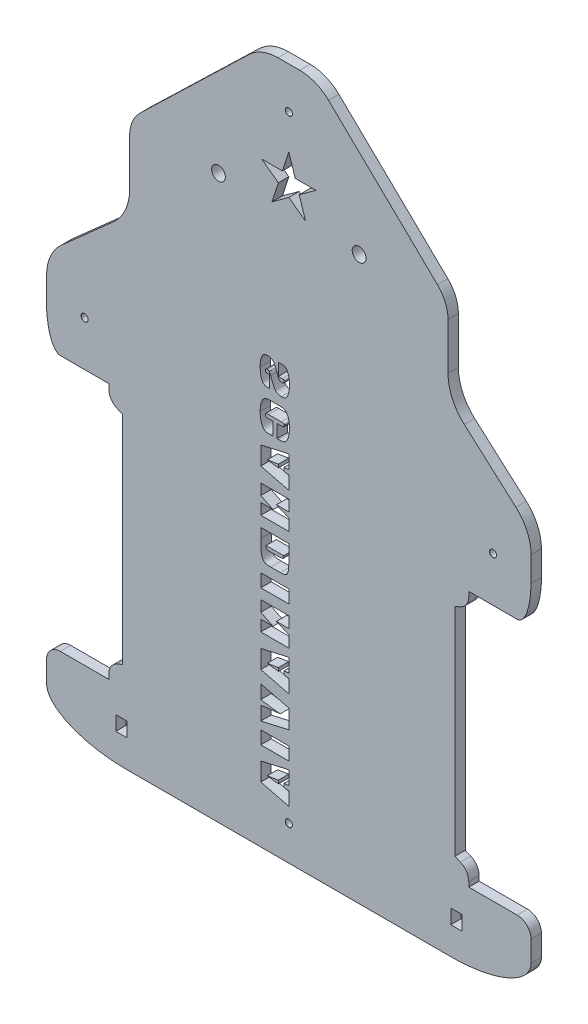
from build123d import *

# Parameters (mm, degrees)
BOSS_EXTRUDE1_DEPTH             = 3
FILLET1_SIZE                    = 23
FILLET1_SIZE_2                  = 10
FILLET2_SIZE                    = 23
FILLET2_SIZE_2                  = 10
FILLET3_R                       = 12
FILLET4_R                       = 4
FILLET5_SIZE                    = 4
FILLET5_SIZE_2                  = 11
MIRROR3_DEPTH                   = 3
FILLET6_R                       = 13
FILLET7_R                       = 4
SKETCH4_R                       = 2
CUT_EXTRUDE1_DEPTH              = 3
F_2_0MM_DOWEL_HOLE1_D           = 2
F_2_0MM_DOWEL_HOLE1_DEPTH       = 3
F_2_0MM_DOWEL_HOLE1_CSINK_D     = 2.05
F_2_0MM_DOWEL_HOLE1_CSINK_ANGLE = 90
F_2_0MM_DOWEL_HOLE1_TIP         = 0.600860619
SKETCH8_W                       = 3.2
SKETCH8_H                       = 4.18
CUT_EXTRUDE2_DEPTH              = 3
CUT_EXTRUDE3_DEPTH              = 3
SKETCH12_W                      = 8.094117647
SKETCH12_H                      = 3.764705883
SKETCH12_H_2                    = 3.764705882
CUT_EXTRUDE4_DEPTH              = 3


# Read off the part's stored shape, not the designer's step: Mirror3
with BuildPart() as part:
    # Sketch2 → Boss-Extrude1 (new body)
    with BuildSketch(Plane.XY):
        with BuildLine():
            Line((8, 200), (-8, 200))
            Line((-8, 200), (-42.946583705, 166.252476399))
            ThreePointArc((-42.946583705, 166.252476399), (-45.205048535, 162.96638968), (-46, 159.059078395))
            Line((-46, 159.059078395), (-46, 145.596532944))
            ThreePointArc((-46, 145.596532944), (-47.230610625, 139.856960225), (-50.706099285, 135.126413102))
            Line((-50.706099285, 135.126413102), (-70, 118))
            Line((-70, 118), (-70, 94))
            Line((-70, 94), (-52, 94))
            Line((-52, 94), (-52, 89.967489246))
            Line((-52, 89.967489246), (-48, 88.269589981))
            Line((-48, 88.269589981), (-48, 25.730410019))
            Line((-48, 25.730410019), (-52, 24.032510754))
            Line((-52, 24.032510754), (-52, 20))
            Line((-52, 20), (-70, 20))
            Line((-70, 20), (-70, 0))
            Line((-70, 0), (70, 0))
            Line((70, 0), (70, 20))
            Line((70, 20), (52, 20))
            Line((52, 20), (52, 24.032510754))
            Line((52, 24.032510754), (48, 25.730410019))
            Line((48, 25.730410019), (48, 88.269589981))
            Line((48, 88.269589981), (52, 89.967489246))
            Line((52, 89.967489246), (52, 94))
            Line((52, 94), (70, 94))
            Line((70, 94), (70, 118))
            Line((70, 118), (50.706099285, 135.126413102))
            ThreePointArc((50.706099285, 135.126413102), (47.230610625, 139.856960225), (46, 145.596532944))
            Line((46, 145.596532944), (46, 159.059078395))
            ThreePointArc((46, 159.059078395), (45.205048535, 162.96638968), (42.946583705, 166.252476399))
            Line((42.946583705, 166.252476399), (8, 200))
        make_face()
    extrude(amount=BOSS_EXTRUDE1_DEPTH)

    # Fillet1
    # an asymmetric fillet: 23, 10 mm, written as the material it takes off along each edge
    with BuildSketch(Plane(origin=(70, 0, -57.5), x_dir=(-1, 0, 0), z_dir=(0, 0, 1))) as fillet1_piece_1:
        with BuildLine():
            Bezier((FILLET1_SIZE, 0), (0, 0), (0, -FILLET1_SIZE_2), weights=[1, 0.707106781, 1])
            Line((0, -FILLET1_SIZE_2), (0, 0))
            Line((0, 0), (FILLET1_SIZE, 0))
        make_face()
    extrude(amount=118, mode=Mode.SUBTRACT)

    # Fillet2
    # an asymmetric fillet: 23, 10 mm, written as the material it takes off along each edge
    with BuildSketch(Plane(origin=(-70, 0, -57.5), x_dir=(1, 0, 0), z_dir=(0, 0, 1))) as fillet2_piece_1:
        with BuildLine():
            Bezier((FILLET2_SIZE, 0), (0, 0), (0, FILLET2_SIZE_2), weights=[1, 0.707106781, 1])
            Line((0, FILLET2_SIZE_2), (0, 0))
            Line((0, 0), (FILLET2_SIZE, 0))
        make_face()
    extrude(amount=118, mode=Mode.SUBTRACT)

    # Fillet3
    fillet3_edges = [part.edges().sort_by_distance(p)[0] for p in [
        (-8, 200, 1.5),
        (8, 200, 1.5),
    ]]
    fillet(fillet3_edges, radius=FILLET3_R)

    # Fillet4
    fillet4_edges = [part.edges().sort_by_distance(p)[0] for p in [
        (52, 89.967489246, 1.5),
        (52, 24.032510754, 1.5),
        (-52, 24.032510754, 1.5),
        (-52, 89.967489246, 1.5),
    ]]
    fillet(fillet4_edges, radius=FILLET4_R)

    # Fillet5
    # an asymmetric fillet: 11, 4 mm, written as the material it takes off along each edge
    with BuildSketch(Plane(origin=(-70, 94, -27.5), x_dir=(1, 0, 0), z_dir=(0, 0, 1))) as fillet5_piece_1:
        with BuildLine():
            Bezier((FILLET5_SIZE, 0), (0, 0), (0, FILLET5_SIZE_2), weights=[1, 0.707106781, 1])
            Line((0, FILLET5_SIZE_2), (0, 0))
            Line((0, 0), (FILLET5_SIZE, 0))
        make_face()
    extrude(amount=58, mode=Mode.SUBTRACT)

    # Mirror3 outline → Mirror3 (cut)
    with BuildSketch(Plane.XY):
        with BuildLine():
            add(Edge.make_bspline(
                [(66, 94), (70, 94), (70, 105)],
                knots=[0, 0, 0, 1, 1, 1], degree=2, weights=[1, 0.707106781, 1]))
            Line((66, 94), (70, 94))
            Line((70, 94), (70, 105))
        make_face()
    extrude(amount=MIRROR3_DEPTH, mode=Mode.SUBTRACT)

    # Fillet6
    fillet6_edges = [part.edges().sort_by_distance(p)[0] for p in [
        (-70, 118, 1.5),
        (70, 118, 1.5),
    ]]
    fillet(fillet6_edges, radius=FILLET6_R)

    # Fillet7
    fillet7_edges = [part.edges().sort_by_distance(p)[0] for p in [
        (-70, 20, 1.5),
        (70, 20, 1.5),
    ]]
    fillet(fillet7_edges, radius=FILLET7_R)

    # Sketch4 → Cut-Extrude1 (cut)
    with BuildSketch(Plane.XY.offset(3)):
        with Locations((20.32, 162.5)):
            Circle(SKETCH4_R)
        with Locations((-20.32, 162.5)):
            Circle(SKETCH4_R)
    extrude(amount=-CUT_EXTRUDE1_DEPTH, mode=Mode.SUBTRACT)

    # Ø2.0mm Dowel Hole1
    with Locations(Plane.XY.offset(3)):
        with Locations((59, 107), (-59, 107), (0, 10), (0, 188)):
            CounterSinkHole(F_2_0MM_DOWEL_HOLE1_D / 2, F_2_0MM_DOWEL_HOLE1_CSINK_D / 2, depth=F_2_0MM_DOWEL_HOLE1_DEPTH, counter_sink_angle=F_2_0MM_DOWEL_HOLE1_CSINK_ANGLE)
            with Locations((0, 0, -(F_2_0MM_DOWEL_HOLE1_DEPTH + F_2_0MM_DOWEL_HOLE1_TIP / 2))):  # 118° drill point
                Cone(0, F_2_0MM_DOWEL_HOLE1_D / 2, F_2_0MM_DOWEL_HOLE1_TIP, mode=Mode.SUBTRACT)

    # Sketch8 → Cut-Extrude2 (cut)
    with BuildSketch(Plane(origin=(0, 0, 0), x_dir=(-1, 0, 0), z_dir=(0, 0, -1))):
        with Locations((-48.4, 10.09)):
            Rectangle(SKETCH8_W, SKETCH8_H)
    cut_extrude2 = extrude(amount=-CUT_EXTRUDE2_DEPTH, mode=Mode.SUBTRACT)

    # Mirror4: Cut-Extrude2 across plane
    add(cut_extrude2.mirror(Plane(origin=(0, 0, 0), x_dir=(0, 0, 1), z_dir=(1, 0, 0))), mode=Mode.SUBTRACT)

    # Sketch9 → Cut-Extrude3 (cut)
    with BuildSketch(Plane(origin=(0, 0, 0), x_dir=(-1, 0, 0), z_dir=(0, 0, -1))):
        Polygon((0, 166.587321804), (-4.854101966, 163.060610291), (-3, 168.766949388), (-7.854101966, 172.293660902), (-1.854101966, 172.293660902), (0, 178), (1.854101966, 172.293660902), (7.854101966, 172.293660902), (3, 168.766949388), (4.854101966, 163.060610291), align=None)
    extrude(amount=-CUT_EXTRUDE3_DEPTH, mode=Mode.SUBTRACT)

    # Sketch12 → Cut-Extrude4 (cut)
    # profile 1 of 11: a face of its own
    with BuildSketch(Plane(origin=(0, 0, 0), x_dir=(-1, 0, 0), z_dir=(0, 0, -1))):
        Polygon((8.094117647, 16.254117647), (0, 14.230588235), (0, 18.055588235), (1.411764706, 18.242352941), (1.411764706, 19.257058824), (0, 19.443823529), (0, 23.36), (8.094117647, 21.530588235), align=None)
        with BuildLine():
            add(Edge.make_bspline(
                [(3.011764706, 18.320294118), (3.118579377, 18.339204457), (3.340301315, 18.37845784), (3.685047135, 18.433650847), (4.053185485, 18.489598862), (4.443799062, 18.545659213), (4.858142451, 18.599740111), (5.295432456, 18.653928694), (5.756206062, 18.708509228), (6.071056054, 18.74352969), (6.232352941, 18.761470588)],
                knots=[0, 0, 0, 0, 0.800721052, 1.66210711, 2.577115263, 3.549400435, 4.574967221, 5.661551264, 6.802018386, 8, 8, 8, 8], degree=3))
            add(Edge.make_bspline(
                [(6.232352941, 18.761470588), (6.047038541, 18.787308039), (5.691034923, 18.836943824), (5.179287936, 18.91061554), (4.710993534, 18.979221936), (4.286569561, 19.04554254), (3.905669031, 19.107233612), (3.568683071, 19.163911742), (3.275593755, 19.21830566), (3.095056481, 19.254887494), (3.011764706, 19.271764706)],
                knots=[0, 0, 0, 0, 1.37693435, 2.645199778, 3.804813673, 4.859913969, 5.806434619, 6.644422833, 7.374597688, 8, 8, 8, 8], degree=3))
            Line((3.011764706, 19.271764706), (3.011764706, 18.320294118))
        make_face(mode=Mode.SUBTRACT)
    # profile 2 of 11: a face of its own
    with BuildSketch(Plane(origin=(0, 0, 0), x_dir=(-1, 0, 0), z_dir=(0, 0, -1))):
        with Locations((4.047058824, 27.444705883)):
            Rectangle(SKETCH12_W, SKETCH12_H)
    # profile 3 of 11: a face of its own
    with BuildSketch(Plane(origin=(0, 0, 0), x_dir=(-1, 0, 0), z_dir=(0, 0, -1))):
        with BuildLine():
            Line((8.094117647, 31.529411765), (0, 33.363235294))
            Line((0, 33.363235294), (0, 38.827941176))
            Line((0, 38.827941176), (8.094117647, 40.847058824))
            Line((8.094117647, 40.847058824), (8.094117647, 36.914705882))
            add(Edge.make_bspline(
                [(8.094117647, 36.914705882), (7.819247392, 36.863010741), (7.281822949, 36.761936754), (6.491385591, 36.625711555), (5.736583227, 36.503194736), (5.016487904, 36.39668137), (4.331964967, 36.307455525), (3.682535835, 36.231479981), (3.068176256, 36.172137715), (2.669668987, 36.143362257), (2.476470588, 36.129411765)],
                knots=[0, 0, 0, 0, 1.182674028, 2.312356176, 3.391595161, 4.41614021, 5.390322273, 6.310535267, 7.180938701, 8, 8, 8, 8], degree=3))
            add(Edge.make_bspline(
                [(2.476470588, 36.129411765), (2.662759325, 36.114389487), (3.030021968, 36.084773519), (3.573235168, 36.037950375), (4.101194315, 35.987945527), (4.613971711, 35.935139452), (5.111561068, 35.879390972), (5.593798264, 35.820003942), (6.061170552, 35.760707308), (6.367208644, 35.717049165), (6.517647059, 35.695588235)],
                knots=[0, 0, 0, 0, 1.10339171, 2.175303578, 3.218915992, 4.234298085, 5.218648938, 6.174929363, 7.102854382, 8, 8, 8, 8], degree=3))
            Line((6.517647059, 35.695588235), (8.094117647, 35.470588235))
            Line((8.094117647, 35.470588235), (8.094117647, 31.529411765))
        make_face()
    # profile 4 of 11: a face of its own
    with BuildSketch(Plane(origin=(0, 0, 0), x_dir=(-1, 0, 0), z_dir=(0, 0, -1))):
        Polygon((8.094117647, 44.414117647), (0, 42.390588235), (0, 46.215588235), (1.411764706, 46.402352941), (1.411764706, 47.417058824), (0, 47.603823529), (0, 51.52), (8.094117647, 49.690588235), align=None)
        with BuildLine():
            add(Edge.make_bspline(
                [(3.011764706, 46.480294118), (3.118579377, 46.499204457), (3.340301315, 46.53845784), (3.685047135, 46.593650847), (4.053185485, 46.649598862), (4.443799062, 46.705659213), (4.858142451, 46.759740111), (5.295432456, 46.813928694), (5.756206062, 46.868509228), (6.071056054, 46.90352969), (6.232352941, 46.921470588)],
                knots=[0, 0, 0, 0, 0.800721052, 1.66210711, 2.577115263, 3.549400435, 4.574967221, 5.661551264, 6.802018386, 8, 8, 8, 8], degree=3))
            add(Edge.make_bspline(
                [(6.232352941, 46.921470588), (6.047038541, 46.947308039), (5.691034923, 46.996943824), (5.179287936, 47.07061554), (4.710993534, 47.139221936), (4.286569561, 47.20554254), (3.905669031, 47.267233612), (3.568683071, 47.323911742), (3.275593755, 47.37830566), (3.095056481, 47.414887494), (3.011764706, 47.431764706)],
                knots=[0, 0, 0, 0, 1.37693435, 2.645199778, 3.804813673, 4.859913969, 5.806434619, 6.644422833, 7.374597688, 8, 8, 8, 8], degree=3))
            Line((3.011764706, 47.431764706), (3.011764706, 46.480294118))
        make_face(mode=Mode.SUBTRACT)
    # profile 5 of 11: a face of its own
    with BuildSketch(Plane(origin=(0, 0, 0), x_dir=(-1, 0, 0), z_dir=(0, 0, -1))):
        Polygon((8.094117647, 53.816470588), (0, 53.816470588), (0, 57.170882353), (3.594117647, 58.710588235), (0, 58.710588235), (0, 61.910588235), (8.094117647, 61.910588235), (8.094117647, 58.763529412), (4.533823529, 57.016470588), (8.094117647, 57.016470588), align=None)
    # profile 6 of 11: a face of its own
    with BuildSketch(Plane(origin=(0, 0, 0), x_dir=(-1, 0, 0), z_dir=(0, 0, -1))):
        with Locations((4.047058824, 66.748235294)):
            Rectangle(SKETCH12_W, SKETCH12_H_2)
    # profile 7 of 11: a face of its own
    with BuildSketch(Plane(origin=(0, 0, 0), x_dir=(-1, 0, 0), z_dir=(0, 0, -1))):
        with BuildLine():
            Line((8.094117647, 79.962352941), (8.094117647, 77.222647059))
            add(Edge.make_bspline(
                [(8.094117647, 77.222647059), (8.094459075, 77.117252992), (8.095127654, 76.910871943), (8.090343637, 76.607951528), (8.090834883, 76.317722786), (8.084910718, 76.040300362), (8.081922255, 75.775543137), (8.073560753, 75.523623828), (8.06617133, 75.284415055), (8.05995299, 75.057855608), (8.048529142, 74.844213857), (8.038933491, 74.643171064), (8.027284717, 74.454907459), (8.013476009, 74.279492438), (8.001052282, 74.117116752), (7.985946834, 73.967134197), (7.970452535, 73.830251582), (7.946453974, 73.666479664), (7.91601603, 73.476564815), (7.869559696, 73.260957739), (7.818926465, 73.058601994), (7.761498018, 72.869630483), (7.698272739, 72.694371771), (7.630090911, 72.532046688), (7.55274458, 72.38419017), (7.470616161, 72.249502852), (7.385689496, 72.126741002), (7.296372894, 72.017833241), (7.207674628, 71.919003645), (7.116437485, 71.832994729), (7.022592937, 71.760875154), (6.928911633, 71.697625427), (6.831110147, 71.649467763), (6.728823086, 71.610728659), (6.613939748, 71.583425535), (6.480938018, 71.55864696), (6.325017098, 71.536259195), (6.145730377, 71.521618751), (5.944239105, 71.508299612), (5.720189214, 71.497944265), (5.4735604, 71.492217972), (5.301473631, 71.491920026), (5.211764706, 71.491764706)],
                knots=[0, 0, 0, 0, 1.666520981, 3.263355872, 4.790373839, 6.255546593, 7.650967229, 8.976999245, 10.241048968, 11.435372061, 12.56061375, 13.623921692, 14.618018947, 15.543053204, 16.406266635, 17.192971833, 17.926562188, 18.584278441, 19.810154422, 20.967067361, 22.070608396, 23.107801184, 24.088573033, 25.015780601, 25.889440834, 26.724277126, 27.509147262, 28.247594668, 28.949929009, 29.608010559, 30.226656321, 30.820020239, 31.391987628, 31.946297594, 32.546006754, 33.255956197, 34.085775594, 35.035265442, 36.099477078, 37.278917374, 38.581498173, 40, 40, 40, 40], degree=3))
            Line((5.211764706, 71.491764706), (2.442647059, 71.491764706))
            add(Edge.make_bspline(
                [(2.442647059, 71.491764706), (2.357339753, 71.492211998), (2.19402889, 71.493068288), (1.960193591, 71.502695231), (1.747611937, 71.514233746), (1.556514824, 71.53591291), (1.385694637, 71.558864307), (1.236734049, 71.592084081), (1.108216795, 71.627232434), (0.965757335, 71.684101938), (0.810770594, 71.78006035), (0.647876044, 71.929404898), (0.504142097, 72.11417675), (0.384258836, 72.334991041), (0.282535402, 72.583688129), (0.198491663, 72.856236463), (0.128470333, 73.150239182), (0.088034658, 73.412546464), (0.063587266, 73.641111321), (0.04572183, 73.834716844), (0.031289873, 74.048508722), (0.019688456, 74.282371146), (0.010918665, 74.536323781), (0.005670622, 74.809888897), (0.000644231, 75.10302169), (0.000219547, 75.304997438), (0, 75.409411765)],
                knots=[0, 0, 0, 0, 1.116015087, 2.136480409, 3.061820122, 3.900390244, 4.652297892, 5.315245783, 5.895796426, 6.393614494, 7.317552935, 8.261922104, 9.271608702, 10.365474368, 11.538646095, 12.782079459, 14.093470504, 15.489498866, 16.250865527, 17.10093279, 18.033092846, 19.054122318, 20.164317328, 21.357495989, 22.633918784, 24, 24, 24, 24], degree=3))
            Line((0, 75.409411765), (0, 79.962352941))
            Line((0, 79.962352941), (8.094117647, 79.962352941))
        make_face()
        with BuildLine():
            Line((6.588235294, 76.197647059), (1.505882353, 76.197647059))
            add(Edge.make_bspline(
                [(1.505882353, 76.197647059), (1.506514805, 76.1491092), (1.507722981, 76.056386989), (1.5148729, 75.92438646), (1.526619634, 75.806144784), (1.541637012, 75.70166642), (1.564038141, 75.611331705), (1.589496571, 75.534420832), (1.620710597, 75.471706603), (1.6566916, 75.418333428), (1.710026689, 75.379051708), (1.777795877, 75.344698875), (1.865209139, 75.318806274), (1.970655757, 75.294647199), (2.095290788, 75.278640766), (2.238456006, 75.264938415), (2.400434034, 75.258414476), (2.51470325, 75.257142026), (2.575, 75.256470588)],
                knots=[0, 0, 0, 0, 1.330565612, 2.541788812, 3.622135562, 4.587567132, 5.431661566, 6.171080269, 6.802062011, 7.350363739, 7.914890912, 8.593974043, 9.42687081, 10.404845201, 11.558343011, 12.867360962, 14.346991784, 16, 16, 16, 16], degree=3))
            Line((2.575, 75.256470588), (5.688235294, 75.256470588))
            add(Edge.make_bspline(
                [(5.688235294, 75.256470588), (5.729899907, 75.257032795), (5.808818232, 75.258097689), (5.92112981, 75.25851004), (6.021130761, 75.263397038), (6.108441302, 75.268836121), (6.183011454, 75.276145595), (6.244875952, 75.284759378), (6.294675595, 75.294415013), (6.345293209, 75.309750836), (6.397957027, 75.341599293), (6.448442114, 75.399484271), (6.492800625, 75.47395849), (6.527602664, 75.569759685), (6.555204245, 75.688656649), (6.574783607, 75.833854985), (6.585741727, 76.006792139), (6.587364055, 76.130963373), (6.588235294, 76.197647059)],
                knots=[0, 0, 0, 0, 1.236430555, 2.341964124, 3.332002206, 4.206653537, 4.937542564, 5.554644633, 6.059554984, 6.441350093, 7.119850631, 7.850739657, 8.698865329, 9.679455857, 10.861295382, 12.315600714, 14.021366786, 16, 16, 16, 16], degree=3))
        make_face(mode=Mode.SUBTRACT)
    # profile 8 of 11: a face of its own
    with BuildSketch(Plane(origin=(0, 0, 0), x_dir=(-1, 0, 0), z_dir=(0, 0, -1))):
        Polygon((8.094117647, 83.011764706), (0, 83.011764706), (0, 86.366176471), (3.594117647, 87.905882353), (0, 87.905882353), (0, 91.105882353), (8.094117647, 91.105882353), (8.094117647, 87.958823529), (4.533823529, 86.211764706), (8.094117647, 86.211764706), align=None)
    # profile 9 of 11: a face of its own
    with BuildSketch(Plane(origin=(0, 0, 0), x_dir=(-1, 0, 0), z_dir=(0, 0, -1))):
        Polygon((8.094117647, 95.331764706), (0, 93.308235294), (0, 97.133235294), (1.411764706, 97.32), (1.411764706, 98.334705882), (0, 98.521470588), (0, 102.437647059), (8.094117647, 100.608235294), align=None)
        with BuildLine():
            add(Edge.make_bspline(
                [(3.011764706, 97.397941176), (3.118579377, 97.416851516), (3.340301315, 97.456104899), (3.685047135, 97.511297906), (4.053185485, 97.567245921), (4.443799062, 97.623306272), (4.858142451, 97.67738717), (5.295432456, 97.731575752), (5.756206062, 97.786156287), (6.071056054, 97.821176749), (6.232352941, 97.839117647)],
                knots=[0, 0, 0, 0, 0.800721052, 1.66210711, 2.577115263, 3.549400435, 4.574967221, 5.661551264, 6.802018386, 8, 8, 8, 8], degree=3))
            add(Edge.make_bspline(
                [(6.232352941, 97.839117647), (6.047038541, 97.864955098), (5.691034923, 97.914590883), (5.179287936, 97.988262599), (4.710993534, 98.056868994), (4.286569561, 98.123189599), (3.905669031, 98.184880671), (3.568683071, 98.241558801), (3.275593755, 98.295952719), (3.095056481, 98.332534553), (3.011764706, 98.349411765)],
                knots=[0, 0, 0, 0, 1.37693435, 2.645199778, 3.804813673, 4.859913969, 5.806434619, 6.644422833, 7.374597688, 8, 8, 8, 8], degree=3))
            Line((3.011764706, 98.349411765), (3.011764706, 97.397941176))
        make_face(mode=Mode.SUBTRACT)
    # profile 10 of 11: a face of its own
    with BuildSketch(Plane(origin=(0, 0, 0), x_dir=(-1, 0, 0), z_dir=(0, 0, -1))):
        with BuildLine():
            Line((4.517647059, 104.545882353), (4.517647059, 108.310588235))
            Line((4.517647059, 108.310588235), (5.979411765, 108.310588235))
            add(Edge.make_bspline(
                [(5.979411765, 108.310588235), (6.024023135, 108.310837228), (6.108368354, 108.311307989), (6.228039662, 108.315647853), (6.333982446, 108.322856105), (6.426357822, 108.332482021), (6.504241288, 108.346072337), (6.56882644, 108.359530807), (6.619345187, 108.378465709), (6.671004081, 108.407902408), (6.718534847, 108.469399297), (6.752351691, 108.56827202), (6.773513347, 108.696969477), (6.775417235, 108.792840371), (6.776470588, 108.845882353)],
                knots=[0, 0, 0, 0, 1.380943683, 2.61090383, 3.706083904, 4.66794713, 5.483697493, 6.153604121, 6.705956583, 7.148359332, 7.97796424, 9.034731194, 10.359421431, 12, 12, 12, 12], degree=3))
            add(Edge.make_bspline(
                [(6.776470588, 108.845882353), (6.774815665, 108.8939839), (6.771782201, 108.982153766), (6.749899935, 109.10189132), (6.704862681, 109.193731318), (6.65070349, 109.250099908), (6.593643103, 109.280315265), (6.535712747, 109.295731104), (6.464810107, 109.312533759), (6.3787893, 109.325625708), (6.278003033, 109.333033812), (6.162848059, 109.341013063), (6.033361832, 109.345093203), (5.942158824, 109.345610085), (5.894117647, 109.345882353)],
                knots=[0, 0, 0, 0, 1.440123002, 2.639737395, 3.610577474, 4.461049287, 4.926964245, 5.525469804, 6.247768684, 7.108674582, 8.124562814, 9.270989093, 10.562493707, 12, 12, 12, 12], degree=3))
            Line((5.894117647, 109.345882353), (2.166176471, 109.345882353))
            add(Edge.make_bspline(
                [(2.166176471, 109.345882353), (2.120096988, 109.345603223), (2.032326304, 109.345071545), (1.907726791, 109.341054956), (1.797020137, 109.332968047), (1.700035846, 109.325875877), (1.617887456, 109.311643443), (1.548837062, 109.298530409), (1.494552223, 109.278920572), (1.438132398, 109.253143258), (1.386168498, 109.197795403), (1.345951578, 109.110386509), (1.321716938, 108.998600188), (1.319088464, 108.916115416), (1.317647059, 108.870882353)],
                knots=[0, 0, 0, 0, 1.443283468, 2.74911894, 3.903165773, 4.920656302, 5.791468973, 6.514212296, 7.116324427, 7.596955945, 8.443751978, 9.41877152, 10.584503915, 12, 12, 12, 12], degree=3))
            add(Edge.make_bspline(
                [(1.317647059, 108.870882353), (1.318561914, 108.816751382), (1.320226204, 108.718277222), (1.35003228, 108.586373008), (1.393566715, 108.482168455), (1.453307437, 108.41782849), (1.516908133, 108.387494076), (1.577591634, 108.364971384), (1.654333422, 108.348372844), (1.746376999, 108.336058748), (1.853715257, 108.324022916), (1.976830484, 108.315292785), (2.115170236, 108.311438891), (2.212253348, 108.310881134), (2.263235294, 108.310588235)],
                knots=[0, 0, 0, 0, 1.487279482, 2.705634021, 3.702307848, 4.571083054, 5.04206048, 5.631468785, 6.35195354, 7.19776708, 8.189215244, 9.326159486, 10.595867092, 12, 12, 12, 12], degree=3))
            Line((2.263235294, 108.310588235), (3.388235294, 108.310588235))
            Line((3.388235294, 108.310588235), (3.388235294, 104.545882353))
            Line((3.388235294, 104.545882353), (2.980882353, 104.545882353))
            add(Edge.make_bspline(
                [(2.980882353, 104.545882353), (2.880373143, 104.546548277), (2.687079664, 104.547828945), (2.407896024, 104.56259008), (2.150794127, 104.587297455), (1.915191406, 104.620857926), (1.700539355, 104.662300913), (1.508343641, 104.716387118), (1.337666095, 104.779845302), (1.184177909, 104.85222797), (1.044976375, 104.944719989), (0.915590607, 105.060347475), (0.787922375, 105.196277544), (0.666559511, 105.357754046), (0.54930511, 105.542749836), (0.434645438, 105.749651971), (0.326262495, 105.981153429), (0.220835206, 106.233326835), (0.124153868, 106.505494968), (0.040429644, 106.794273562), (-0.029372267, 107.097886131), (-0.089053421, 107.415586398), (-0.131945201, 107.748612461), (-0.163991538, 108.095889743), (-0.185819377, 108.457859825), (-0.18741976, 108.704182926), (-0.188235294, 108.829705882)],
                knots=[0, 0, 0, 0, 1.168564992, 2.247316372, 3.249460331, 4.170787558, 5.01361212, 5.789484374, 6.489272818, 7.129114089, 7.758280136, 8.424755988, 9.142557061, 9.923437686, 10.769321024, 11.687752321, 12.671872344, 13.73990979, 14.864818792, 16.028243291, 17.23383569, 18.485904426, 19.785337565, 21.136300329, 22.540696968, 24, 24, 24, 24], degree=3))
            add(Edge.make_bspline(
                [(-0.188235294, 108.829705882), (-0.186867775, 108.956677075), (-0.184189909, 109.205311151), (-0.170253301, 109.569787575), (-0.143545223, 109.917509702), (-0.106900517, 110.248593261), (-0.060991626, 110.563378551), (-0.001023136, 110.860786692), (0.06491309, 111.142189362), (0.145173399, 111.405318253), (0.232054479, 111.650345073), (0.328776553, 111.874705382), (0.435090892, 112.076882765), (0.548035352, 112.259106998), (0.669923688, 112.420286419), (0.801144773, 112.55994216), (0.941882668, 112.676751703), (1.09212481, 112.775105026), (1.257147364, 112.854227258), (1.437230119, 112.923187162), (1.635640399, 112.982658916), (1.852946298, 113.02759903), (2.087730576, 113.066945749), (2.340686684, 113.09256073), (2.612089882, 113.106707057), (2.799002393, 113.109265946), (2.895588235, 113.110588235)],
                knots=[0, 0, 0, 0, 1.484325832, 2.906596163, 4.262875816, 5.560128654, 6.800047893, 7.980045448, 9.105827886, 10.177210937, 11.194061489, 12.143633622, 13.030498899, 13.862044853, 14.647117472, 15.388898684, 16.096910203, 16.780355614, 17.482545912, 18.23172706, 19.033068696, 19.900751082, 20.823970526, 21.814965337, 22.87089735, 24, 24, 24, 24], degree=3))
            Line((2.895588235, 113.110588235), (5.217647059, 113.110588235))
            add(Edge.make_bspline(
                [(5.217647059, 113.110588235), (5.28823613, 113.110282815), (5.425017196, 113.109691001), (5.623618532, 113.105809397), (5.808927492, 113.096663684), (5.981036101, 113.085108073), (6.139462484, 113.070718992), (6.284598153, 113.052890815), (6.41677886, 113.033048322), (6.538261472, 113.007920396), (6.653219712, 112.97584144), (6.764292903, 112.929109562), (6.874069653, 112.870528093), (6.982577626, 112.798782927), (7.089909129, 112.714340896), (7.197408051, 112.617873113), (7.301171498, 112.506079903), (7.406184377, 112.384592733), (7.506935651, 112.250311605), (7.601526924, 112.102988207), (7.691058553, 111.944478325), (7.77467509, 111.773473071), (7.85306501, 111.590510937), (7.923768449, 111.395030625), (7.992828632, 111.188743235), (8.072735592, 110.892672703), (8.158357167, 110.500810773), (8.231809304, 110.004702896), (8.273940703, 109.477503031), (8.279498776, 109.115566449), (8.282352941, 108.929705882)],
                knots=[0, 0, 0, 0, 0.982054364, 1.902935426, 2.76318596, 3.562948923, 4.302622447, 4.975940605, 5.597091246, 6.161518339, 6.701090746, 7.254534423, 7.834205313, 8.430018618, 9.061638202, 9.732777051, 10.437086242, 11.181960195, 11.966220812, 12.770159808, 13.616044794, 14.49747069, 15.417113583, 16.383726367, 17.388694944, 18.442591325, 20.648378957, 22.965015719, 25.414450259, 28, 28, 28, 28], degree=3))
            add(Edge.make_bspline(
                [(8.282352941, 108.929705882), (8.281318749, 108.799780301), (8.2792962, 108.545687257), (8.260691059, 108.172503358), (8.233638943, 107.815841427), (8.194580398, 107.475179371), (8.14107982, 107.151578548), (8.078241518, 106.844377412), (8.005447441, 106.552810575), (7.918446073, 106.280030537), (7.825277276, 106.026078583), (7.725255984, 105.794248185), (7.619587578, 105.584791426), (7.5085427, 105.397298877), (7.39077057, 105.233561094), (7.268360417, 105.091428125), (7.138515221, 104.973604549), (7.001905572, 104.874696162), (6.852312751, 104.796655036), (6.689113099, 104.728357047), (6.508854988, 104.671812348), (6.310987585, 104.626698689), (6.096957663, 104.590227534), (5.865280669, 104.563650289), (5.616345524, 104.549828555), (5.444622973, 104.547226836), (5.355882353, 104.545882353)],
                knots=[0, 0, 0, 0, 1.536264436, 3.004443811, 4.417307976, 5.765429754, 7.057634557, 8.294491465, 9.472620814, 10.609250006, 11.678476474, 12.670231135, 13.593105288, 14.45101634, 15.244129499, 15.975370124, 16.664747073, 17.312978147, 17.963898988, 18.655028346, 19.402987278, 20.194595055, 21.053210789, 21.969232975, 22.950565749, 24, 24, 24, 24], degree=3))
            Line((5.355882353, 104.545882353), (4.517647059, 104.545882353))
        make_face()
    # profile 11 of 11: a face of its own
    with BuildSketch(Plane(origin=(0, 0, 0), x_dir=(-1, 0, 0), z_dir=(0, 0, -1))):
        with BuildLine():
            Line((5.552941176, 115.971764706), (5.552941176, 119.548235294))
            Line((5.552941176, 119.548235294), (6.233823529, 119.548235294))
            add(Edge.make_bspline(
                [(6.233823529, 119.548235294), (6.289781418, 119.549017531), (6.390280134, 119.550422406), (6.523026829, 119.567465667), (6.622368191, 119.591847913), (6.692537512, 119.634495036), (6.732163356, 119.697430815), (6.758012852, 119.773360364), (6.773421649, 119.866764186), (6.775401347, 119.934941772), (6.776470588, 119.971764706)],
                knots=[0, 0, 0, 0, 1.629798103, 2.92706929, 3.894631295, 4.596038628, 5.253892918, 6.013159222, 6.9269009, 8, 8, 8, 8], degree=3))
            add(Edge.make_bspline(
                [(6.776470588, 119.971764706), (6.775188398, 120.002799117), (6.772710395, 120.06277725), (6.750178376, 120.147083865), (6.714660881, 120.222169908), (6.661425357, 120.285629945), (6.588831033, 120.338592261), (6.491082285, 120.372139222), (6.370410099, 120.391634917), (6.281956443, 120.394004621), (6.233823529, 120.395294118)],
                knots=[0, 0, 0, 0, 0.93964134, 1.81598206, 2.627218597, 3.440088498, 4.302571649, 5.318842577, 6.541022217, 8, 8, 8, 8], degree=3))
            add(Edge.make_bspline(
                [(6.233823529, 120.395294118), (6.170953961, 120.393684197), (6.055488515, 120.390727438), (5.897392447, 120.36798611), (5.76719842, 120.330790603), (5.699703183, 120.28511136), (5.669117647, 120.264411765)],
                knots=[0, 0, 0, 0, 1.279067043, 2.3491182, 3.251901224, 4, 4, 4, 4], degree=3))
            add(Edge.make_bspline(
                [(5.669117647, 120.264411765), (5.650909738, 120.248275004), (5.611223308, 120.213102903), (5.559328512, 120.143144956), (5.505428181, 120.05783612), (5.448672893, 119.955032323), (5.392995644, 119.833480012), (5.333513269, 119.695131911), (5.275288373, 119.538708634), (5.237475859, 119.42822926), (5.217647059, 119.370294118)],
                knots=[0, 0, 0, 0, 0.576140738, 1.255771241, 2.056225654, 2.972739952, 4.039744693, 5.228343764, 6.546549526, 8, 8, 8, 8], degree=3))
            add(Edge.make_bspline(
                [(5.217647059, 119.370294118), (5.184536355, 119.272178199), (5.119699519, 119.080049215), (5.020966862, 118.799887627), (4.925610573, 118.532949075), (4.83150868, 118.280655083), (4.74030031, 118.042425365), (4.652634371, 117.818444338), (4.565108237, 117.609622491), (4.482094025, 117.413942185), (4.399649205, 117.232534564), (4.318360458, 117.066035433), (4.243196852, 116.911596225), (4.165874196, 116.774525641), (4.09413787, 116.649683857), (4.024017751, 116.539385652), (3.954892739, 116.443413892), (3.907626146, 116.385766196), (3.885294118, 116.358529412)],
                knots=[0, 0, 0, 0, 1.503113746, 2.943372686, 4.311814326, 5.617665366, 6.851918555, 8.014693747, 9.108844736, 10.138460529, 11.100111415, 12.000753855, 12.828116567, 13.592498656, 14.284463918, 14.918066308, 15.488819207, 16, 16, 16, 16], degree=3))
            add(Edge.make_bspline(
                [(3.885294118, 116.358529412), (3.835313749, 116.304479386), (3.735185386, 116.196198061), (3.557175263, 116.061974172), (3.36322001, 115.945827257), (3.149660966, 115.851760267), (2.917352407, 115.77842538), (2.666677665, 115.725853833), (2.396859659, 115.694862168), (2.210868332, 115.691269348), (2.114705882, 115.689411765)],
                knots=[0, 0, 0, 0, 0.902924807, 1.808877856, 2.727160069, 3.676271593, 4.668675157, 5.71528811, 6.818743353, 8, 8, 8, 8], degree=3))
            add(Edge.make_bspline(
                [(2.114705882, 115.689411765), (2.045067599, 115.690605136), (1.910007976, 115.692919613), (1.71395203, 115.708890702), (1.53147882, 115.736229711), (1.362253049, 115.776066094), (1.206681563, 115.827091578), (1.063629995, 115.889192699), (0.934238291, 115.962332546), (0.816215838, 116.048051194), (0.707844311, 116.150702439), (0.60748394, 116.27381903), (0.509644246, 116.415443572), (0.419384718, 116.578933338), (0.331067032, 116.761355472), (0.247249609, 116.964538019), (0.170445365, 117.189073582), (0.095612534, 117.431005595), (0.028005766, 117.688425488), (-0.027943944, 117.957756359), (-0.079345125, 118.235961641), (-0.117404184, 118.524258565), (-0.151051574, 118.821712421), (-0.17201698, 119.12887554), (-0.18585265, 119.445655148), (-0.187432848, 119.65998434), (-0.188235294, 119.768823529)],
                knots=[0, 0, 0, 0, 0.943732146, 1.830316631, 2.663708271, 3.442003457, 4.183594738, 4.879723114, 5.552115756, 6.193914408, 6.851842448, 7.568895238, 8.342840228, 9.181695059, 10.096841306, 11.088751664, 12.158168495, 13.311840184, 14.520348589, 15.763386067, 17.039137189, 18.353533453, 19.703428769, 21.095463605, 22.525038133, 24, 24, 24, 24], degree=3))
            add(Edge.make_bspline(
                [(-0.188235294, 119.768823529), (-0.187701037, 119.885514592), (-0.18664993, 120.115094256), (-0.169082028, 120.452924006), (-0.145248583, 120.778216603), (-0.109251223, 121.090034855), (-0.066373246, 121.389633681), (-0.00972274, 121.675857946), (0.054295507, 121.949910571), (0.128531413, 122.209217447), (0.212795009, 122.450502269), (0.299352671, 122.673556565), (0.395512929, 122.873378911), (0.495063963, 123.053247464), (0.60209456, 123.211055917), (0.715538577, 123.346860502), (0.833408448, 123.462761802), (0.961640929, 123.554854817), (1.098024788, 123.632465849), (1.245874167, 123.698576562), (1.406833908, 123.754325932), (1.580492633, 123.799417133), (1.766688521, 123.834837732), (1.965699861, 123.858760432), (2.177145777, 123.876127554), (2.3225106, 123.877131963), (2.397058824, 123.877647059)],
                knots=[0, 0, 0, 0, 1.508233042, 2.967319249, 4.37184717, 5.723789361, 7.024092044, 8.282974138, 9.494112386, 10.661322184, 11.767491803, 12.797088602, 13.752236701, 14.631748158, 15.452528772, 16.21273716, 16.916329206, 17.58299963, 18.247135635, 18.941999195, 19.673459233, 20.446551651, 21.259319181, 22.121517406, 23.036647665, 24, 24, 24, 24], degree=3))
            Line((2.397058824, 123.877647059), (3.011764706, 123.877647059))
            Line((3.011764706, 123.877647059), (3.011764706, 120.301176471))
            Line((3.011764706, 120.301176471), (1.936764706, 120.301176471))
            add(Edge.make_bspline(
                [(1.936764706, 120.301176471), (1.90146603, 120.300929771), (1.834759329, 120.300463564), (1.740072619, 120.296095589), (1.656655799, 120.288973165), (1.584305235, 120.279331131), (1.523673898, 120.265432474), (1.472974535, 120.252344386), (1.433683875, 120.232985979), (1.394845195, 120.202941878), (1.361289649, 120.149758956), (1.33630893, 120.07149663), (1.320502229, 119.974329478), (1.318654737, 119.903205121), (1.317647059, 119.864411765)],
                knots=[0, 0, 0, 0, 1.394622385, 2.635528235, 3.743737021, 4.702398536, 5.515388536, 6.201788214, 6.76479108, 7.233637991, 8.125402496, 9.191164386, 10.467976847, 12, 12, 12, 12], degree=3))
            add(Edge.make_bspline(
                [(1.317647059, 119.864411765), (1.319069284, 119.815738771), (1.321737404, 119.724427326), (1.348060409, 119.598065676), (1.390206509, 119.491685547), (1.451820523, 119.405194983), (1.535731483, 119.342119698), (1.635845801, 119.296151473), (1.755576969, 119.270045925), (1.841045544, 119.267333365), (1.886764706, 119.265882353)],
                knots=[0, 0, 0, 0, 1.225044638, 2.298206649, 3.234074119, 4.091326897, 4.936301206, 5.848141604, 6.84892005, 8, 8, 8, 8], degree=3))
            add(Edge.make_bspline(
                [(1.886764706, 119.265882353), (1.940228893, 119.266640339), (2.042434084, 119.268089349), (2.188376903, 119.281360892), (2.319930737, 119.302597159), (2.436306421, 119.333888517), (2.539510684, 119.37026276), (2.625243439, 119.420650052), (2.700502538, 119.474993437), (2.736752822, 119.522265857), (2.754411765, 119.545294118)],
                knots=[0, 0, 0, 0, 1.359148076, 2.59822501, 3.723213426, 4.742107609, 5.661192262, 6.492960237, 7.265861505, 8, 8, 8, 8], degree=3))
            add(Edge.make_bspline(
                [(2.754411765, 119.545294118), (2.77389318, 119.576453521), (2.818374547, 119.647598908), (2.883940023, 119.773481721), (2.955656052, 119.931215911), (3.04125815, 120.117596479), (3.129071835, 120.338187173), (3.229475321, 120.588125239), (3.336752894, 120.870240637), (3.409986629, 121.068756666), (3.448529412, 121.173235294)],
                knots=[0, 0, 0, 0, 0.497523549, 1.135981496, 1.920012013, 2.844105493, 3.912903618, 5.134525969, 6.491906182, 8, 8, 8, 8], degree=3))
            add(Edge.make_bspline(
                [(3.448529412, 121.173235294), (3.488137531, 121.279154428), (3.563937997, 121.48185831), (3.67428022, 121.772229865), (3.776735202, 122.035185308), (3.8721672, 122.269876912), (3.959074394, 122.476911435), (4.038240619, 122.65647972), (4.109646402, 122.808579469), (4.193246509, 122.974622622), (4.305728616, 123.155138179), (4.463221398, 123.349284289), (4.643730199, 123.525070255), (4.812433221, 123.655481352), (4.959943847, 123.747306774), (5.078896416, 123.807681796), (5.205760881, 123.857596611), (5.339072134, 123.900631181), (5.480803085, 123.932997327), (5.629462715, 123.953708288), (5.784941938, 123.969981833), (5.891129637, 123.971160317), (5.945588235, 123.971764706)],
                knots=[0, 0, 0, 0, 1.66674305, 3.189747471, 4.578413407, 5.826180951, 6.923848359, 7.887796033, 8.718430415, 9.40023579, 10.627140877, 11.844670928, 13.076014221, 14.333263496, 14.978889359, 15.634822786, 16.296264193, 16.986326797, 17.697915961, 18.435654241, 19.19772179, 20, 20, 20, 20], degree=3))
            add(Edge.make_bspline(
                [(5.945588235, 123.971764706), (6.022608941, 123.971013733), (6.171559194, 123.969561428), (6.38661423, 123.947768074), (6.585957756, 123.916665876), (6.769514401, 123.870911864), (6.937887053, 123.812799125), (7.08990035, 123.740225061), (7.227637248, 123.656872245), (7.347620565, 123.555573094), (7.45835693, 123.442549698), (7.558591377, 123.313057577), (7.657041959, 123.171983875), (7.746412199, 123.013681894), (7.828108891, 122.839671379), (7.904547345, 122.651106033), (7.974837473, 122.447797515), (8.039475874, 122.230523952), (8.096437394, 121.999797786), (8.145990928, 121.757384474), (8.189318536, 121.503942228), (8.221709048, 121.239269367), (8.250700846, 120.963871094), (8.269423812, 120.676894116), (8.279126214, 120.378695696), (8.281265455, 120.176182962), (8.282352941, 120.073235294)],
                knots=[0, 0, 0, 0, 1.069200578, 2.067725755, 2.998927781, 3.86909913, 4.691598458, 5.468126732, 6.204931957, 6.920580454, 7.64274055, 8.398702894, 9.191825905, 10.030342024, 10.919559805, 11.860146515, 12.854858205, 13.906025283, 15.007362933, 16.154281206, 17.341782026, 18.577182877, 19.856830645, 21.187334683, 22.570177158, 24, 24, 24, 24], degree=3))
            add(Edge.make_bspline(
                [(8.282352941, 120.073235294), (8.281565236, 119.959004447), (8.280012949, 119.73389595), (8.26600233, 119.402448709), (8.246145512, 119.082649966), (8.216750684, 118.775124576), (8.178664799, 118.479348141), (8.131916295, 118.195260094), (8.075614145, 117.923206822), (8.013671743, 117.664332712), (7.943035709, 117.4227118), (7.868530397, 117.200225356), (7.789496138, 116.998784553), (7.70670184, 116.818036249), (7.615672879, 116.660433029), (7.524576135, 116.5206753), (7.425811906, 116.403555095), (7.319832507, 116.306472983), (7.203934754, 116.224864112), (7.072519203, 116.158029918), (6.926803766, 116.098525174), (6.763838448, 116.052443871), (6.584923367, 116.015818583), (6.389882023, 115.989613564), (6.178634956, 115.97566523), (6.032862276, 115.973095704), (5.957352941, 115.971764706)],
                knots=[0, 0, 0, 0, 1.522309453, 2.999932178, 4.420535168, 5.792164446, 7.116232741, 8.394310509, 9.628143829, 10.818114148, 11.940740927, 12.981966877, 13.944001586, 14.823724407, 15.628368483, 16.36763463, 17.044357554, 17.663992283, 18.278404646, 18.927112992, 19.624674488, 20.373092341, 21.180278407, 22.057085495, 22.993582459, 24, 24, 24, 24], degree=3))
            Line((5.957352941, 115.971764706), (5.552941176, 115.971764706))
        make_face()
    extrude(amount=-CUT_EXTRUDE4_DEPTH, mode=Mode.SUBTRACT)


with BuildPart() as cut_extrude4_piece_1:
    # of the separate pieces the step leaves, piece 1, a body of its own (cut_extrude4_pieces)
    add(part.part.solids().sort_by_distance((-66, 20, 0))[0])


with BuildPart() as cut_extrude4_piece_2:
    # of the separate pieces the step leaves, piece 2, a body of its own (cut_extrude4_pieces)
    add(part.part.solids().sort_by_distance((-6.588235294, 76.197647059, 0))[0])


with BuildPart() as cut_extrude4_piece_3:
    # of the separate pieces the step leaves, piece 3, a body of its own (cut_extrude4_pieces)
    add(part.part.solids().sort_by_distance((-3.011764706, 46.480294118, 0))[0])


with BuildPart() as cut_extrude4_piece_4:
    # of the separate pieces the step leaves, piece 4, a body of its own (cut_extrude4_pieces)
    add(part.part.solids().sort_by_distance((-3.011764706, 18.320294118, 0))[0])


with BuildPart() as cut_extrude4_piece_5:
    # of the separate pieces the step leaves, piece 5, a body of its own (cut_extrude4_pieces)
    add(part.part.solids().sort_by_distance((-3.011764706, 97.397941176, 0))[0])


solid = Compound([cut_extrude4_piece_1.part, cut_extrude4_piece_2.part, cut_extrude4_piece_3.part, cut_extrude4_piece_4.part, cut_extrude4_piece_5.part])
